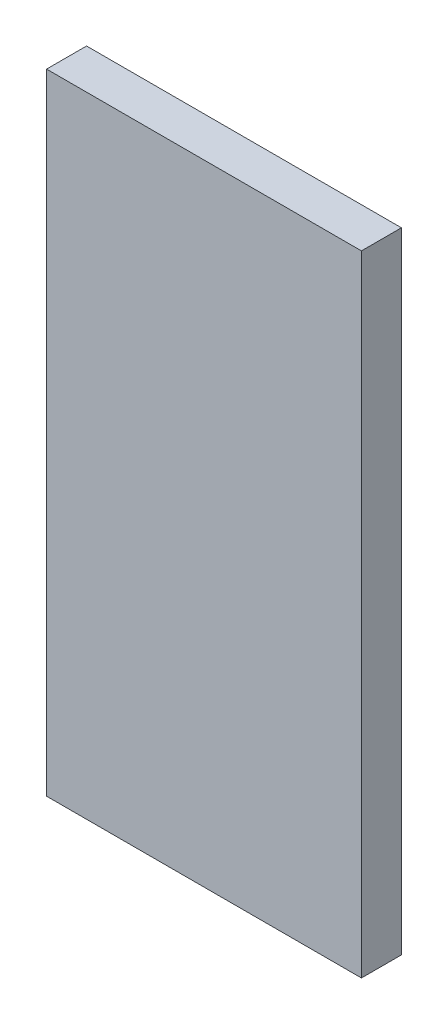
from build123d import *

# Parameters (mm, degrees)
SKETCH1_W           = 100
SKETCH1_H           = 200
BOSS_EXTRUDE1_DEPTH = 12.7


with BuildPart() as part:
    # Sketch1 → Boss-Extrude1 (new body)
    with BuildSketch(Plane.XY):
        with Locations((50, 100)):
            Rectangle(SKETCH1_W, SKETCH1_H)
    extrude(amount=BOSS_EXTRUDE1_DEPTH)


solid = part.part
